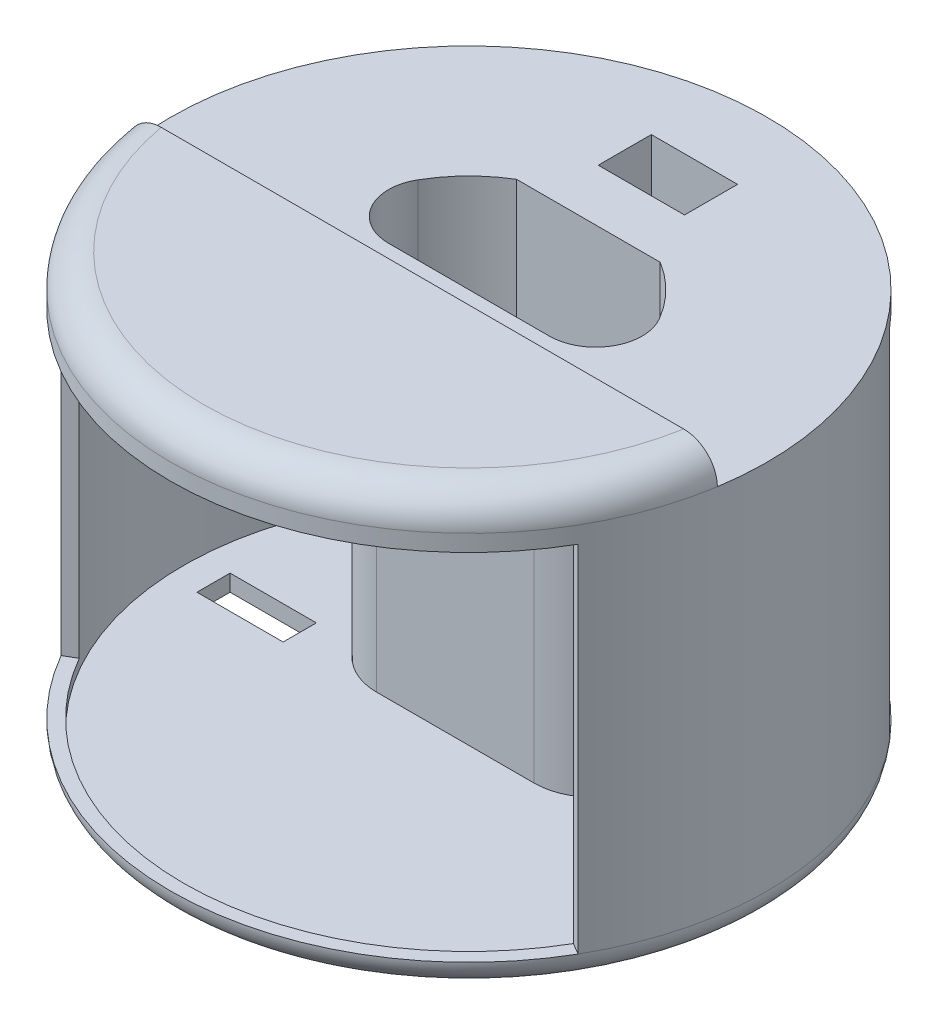
from build123d import *

# Parameters (mm, degrees)
CUT_EXTRUDE1_DEPTH           = 5
CUT_EXTRUDE3_DEPTH           = 60
SKETCH8_R                    = 43
CUT_EXTRUDE4_DEPTH           = 55
FILLET1_R                    = 7
SKETCH12_W                   = 6.5
SKETCH12_H                   = 53.5
CUT_REVOLVE1_ANGLE           = 60
CUT_REVOLVE1_OTHER_WAY_ANGLE = 60
SKETCH18_W                   = 13
SKETCH18_H                   = 8
CUT_EXTRUDE13_DEPTH          = 5
SKETCH20_W                   = 100
SKETCH20_H                   = 7
CUT_EXTRUDE15_DEPTH          = 5
SKETCH19_R                   = 1.5
CUT_EXTRUDE14_DEPTH          = 12
FILLET3_R                    = 4
SKETCH24_W                   = 2
SKETCH24_H                   = 3
BOSS_EXTRUDE3_DEPTH          = 2
CIRPATTERN2_COUNT            = 5
SKETCH26_W                   = 5
SKETCH26_H                   = 53.5
CUT_REVOLVE2_ANGLE           = 50
CUT_REVOLVE2_OTHER_WAY_ANGLE = 50
SKETCH29_W                   = 16.2
SKETCH29_H                   = 11.2
SKETCH29_W_2                 = 13
SKETCH29_H_2                 = 8
BOSS_EXTRUDE4_DEPTH          = 19
SKETCH36_W                   = 2
SKETCH36_H                   = 2
BOSS_EXTRUDE7_DEPTH          = 5
SKETCH37_W                   = 2
SKETCH37_H                   = 2
BOSS_EXTRUDE8_DEPTH          = 12.5
SKETCH40_W                   = 2
SKETCH40_H                   = 2
BOSS_EXTRUDE9_DEPTH          = 5
FILLET8_R                    = 9
SKETCH50_W                   = 13
SKETCH50_H                   = 5
CUT_EXTRUDE23_DEPTH          = 7


with BuildPart() as part:
    # Sketch1 → Revolve1 (revolve)
    with BuildSketch(Plane.XY, mode=Mode.PRIVATE) as revolve1_sk:
        with BuildLine():
            Line((0, 76.5), (0, 11.5))
            Line((0, 11.5), (22.5, 11.5))
            Line((22.5, 11.5), (22.5, 0))
            Line((22.5, 0), (25, 0))
            Line((25, 0), (25, 11.5))
            Line((25, 11.5), (45, 11.5))
            Line((45, 11.5), (45, 71.5))
            ThreePointArc((45, 71.5), (43.535533906, 75.035533906), (40, 76.5))
            Line((40, 76.5), (0, 76.5))
        make_face()
    revolve(revolve1_sk.sketch.rotate(Axis((0, 2, 0), (0, 1, 0)), 90), axis=Axis((0, 2, 0), (0, 1, 0)))

    # Sketch5 → Cut-Extrude1 (cut)
    with BuildSketch(Plane(origin=(0, 76.5, 0), x_dir=(1, 0, 0), z_dir=(0, 1, 0))):
        with BuildLine():
            Line((-45, 0), (45, 0))
            ThreePointArc((45, 0), (0, 45), (-45, 0))
        make_face()
    extrude(amount=-CUT_EXTRUDE1_DEPTH, mode=Mode.SUBTRACT)

    # Sketch7 → Cut-Extrude3 (cut)
    with BuildSketch(Plane.XZ.offset(-11.5)):
        with BuildLine():
            Line((21, 0), (-21, 0))
            ThreePointArc((-21, 0), (-18.277714988, -10.340461055), (-10.816653826, -18))
            Line((-10.816653826, -18), (10.816653826, -18))
            ThreePointArc((10.816653826, -18), (18.277714988, -10.340461055), (21, 0))
        make_face()
    extrude(amount=-CUT_EXTRUDE3_DEPTH, mode=Mode.SUBTRACT)

    # Sketch8 → Cut-Extrude4 (cut)
    with BuildSketch(Plane(origin=(0, 69, 0), x_dir=(1, 0, 0), z_dir=(0, 1, 0))):
        with Locations(Location((0, 0, 0), (0, 0, 270))):
            Circle(SKETCH8_R)
        with BuildLine():
            Line((22.912878475, -2), (-22.981606036, -2))
            ThreePointArc((-22.981606036, -2), (-20.067855169, 10.855581536), (-10.573881727, 20))
            Line((-10.573881727, 20), (10.505154166, 20))
            ThreePointArc((10.505154166, 20), (19.999127608, 10.855581536), (22.912878475, -2))
        make_face(mode=Mode.SUBTRACT)
    extrude(amount=-CUT_EXTRUDE4_DEPTH, mode=Mode.SUBTRACT)

    # Fillet1
    fillet1_edges = [part.edges().sort_by_distance(p)[0] for p in [
        (-21, 41.5, 0),
        (21, 41.5, 0),
    ]]
    fillet(fillet1_edges, radius=FILLET1_R)

    # Sketch12 → Cut-Revolve1 (revolve, cut)
    with BuildSketch(Plane(origin=(0, 0, 0), x_dir=(0, 0, -1), z_dir=(1, 0, 0))):
        with Locations((-44.75, 42.25)):
            Rectangle(SKETCH12_W, SKETCH12_H)
    revolve(axis=Axis((0, 71.5, 0), (0, -1, 0)), revolution_arc=CUT_REVOLVE1_ANGLE, mode=Mode.SUBTRACT)

    # Sketch12 → Cut-Revolve1 other way (revolve, cut)
    with BuildSketch(Plane(origin=(0, 0, 0), x_dir=(0, 0, -1), z_dir=(1, 0, 0))):
        with Locations((-44.75, 42.25)):
            Rectangle(SKETCH12_W, SKETCH12_H)
    revolve(axis=Axis((0, 71.5, 0), (0, 1, 0)), revolution_arc=CUT_REVOLVE1_OTHER_WAY_ANGLE, mode=Mode.SUBTRACT)

    # Sketch18 → Cut-Extrude13 (cut)
    with BuildSketch(Plane(origin=(0, 71.5, 0), x_dir=(1, 0, 0), z_dir=(0, 1, 0))):
        with Locations((0, 30)):
            Rectangle(SKETCH18_W, SKETCH18_H)
    extrude(amount=-CUT_EXTRUDE13_DEPTH, mode=Mode.SUBTRACT)

    # Sketch20 → Cut-Extrude15 (cut)
    with BuildSketch(Plane(origin=(0, 76.5, 0), x_dir=(1, 0, 0), z_dir=(0, 1, 0))):
        with Locations((0, -3.5)):
            Rectangle(SKETCH20_W, SKETCH20_H)
    extrude(amount=-CUT_EXTRUDE15_DEPTH, mode=Mode.SUBTRACT)

    # Sketch19 → Cut-Extrude14 (cut)
    with BuildSketch(Plane(origin=(0, 0, 7), x_dir=(-1, 0, 0), z_dir=(0, 0, -1))):
        with Locations((0, 74)):
            Circle(SKETCH19_R)
        with Locations((-30, 74)):
            Circle(SKETCH19_R)
        with Locations((29.452221542, 74)):
            Circle(SKETCH19_R)
    extrude(amount=-CUT_EXTRUDE14_DEPTH, mode=Mode.SUBTRACT)

    # Fillet3
    fillet3_edges = [part.edges().sort_by_distance(p)[0] for p in [
        (0, 11.5, 45),
    ]]
    fillet(fillet3_edges, radius=FILLET3_R - 0.0001)  # a hair under: the kernel refuses the full size

    # Sketch24 → Boss-Extrude3 (add)
    with BuildSketch(Plane.XZ):
        with Locations((0, -22.5)):
            Rectangle(SKETCH24_W, SKETCH24_H)
    boss_extrude3 = extrude(amount=-BOSS_EXTRUDE3_DEPTH)

    # CirPattern2: Boss-Extrude3 ×5 about axis
    cirpattern2_axis = Axis((0, 0, 0), (0, 1, 0))
    for i in range(1, CIRPATTERN2_COUNT):
        add(boss_extrude3.rotate(cirpattern2_axis, i * 360 / CIRPATTERN2_COUNT))

    # Sketch26 → Cut-Revolve2 (revolve, cut)
    with BuildSketch(Plane(origin=(0, 0, 0), x_dir=(0, 0, -1), z_dir=(1, 0, 0))):
        with Locations((45.056943441, 42.25)):
            Rectangle(SKETCH26_W, SKETCH26_H)
    revolve(axis=Axis((0, 2, 0), (0, -1, 0)), revolution_arc=CUT_REVOLVE2_ANGLE, mode=Mode.SUBTRACT)

    # Sketch26 → Cut-Revolve2 other way (revolve, cut)
    with BuildSketch(Plane(origin=(0, 0, 0), x_dir=(0, 0, -1), z_dir=(1, 0, 0))):
        with Locations((45.056943441, 42.25)):
            Rectangle(SKETCH26_W, SKETCH26_H)
    revolve(axis=Axis((0, 2, 0), (0, 1, 0)), revolution_arc=CUT_REVOLVE2_OTHER_WAY_ANGLE, mode=Mode.SUBTRACT)

    # Sketch29 → Boss-Extrude4 (add)
    with BuildSketch(Plane.XZ.offset(-69)):
        with Locations((0, -30)):
            Rectangle(SKETCH29_W, SKETCH29_H)
        with Locations((0, -30)):
            Rectangle(SKETCH29_W_2, SKETCH29_H_2, mode=Mode.SUBTRACT)
    extrude(amount=BOSS_EXTRUDE4_DEPTH)

    # Fillet8
    fillet8_edges = [part.edges().sort_by_distance(p)[0] for p in [
        (-22.981606036, 41.5, 2),
        (22.912878475, 41.5, 2),
    ]]
    fillet(fillet8_edges, radius=FILLET8_R)

    # Sketch50 → Cut-Extrude23 (cut)
    with BuildSketch(Plane(origin=(0, 14, 0), x_dir=(1, 0, 0), z_dir=(0, 1, 0))):
        with Locations((32, 0)):
            Rectangle(SKETCH50_W, SKETCH50_H)
        with Locations((-32, 0)):
            Rectangle(SKETCH50_W, SKETCH50_H)
    extrude(amount=-CUT_EXTRUDE23_DEPTH, mode=Mode.SUBTRACT)


with BuildPart() as body_2:
    # Sketch36 → Boss-Extrude7 (new body)
    with BuildSketch(Plane(origin=(0, 0, -35.6), x_dir=(-1, 0, 0), z_dir=(0, 0, -1))):
        with Locations((-6.159647943, 37.918102195)):
            Rectangle(SKETCH36_W, SKETCH36_H)
    extrude(amount=BOSS_EXTRUDE7_DEPTH)

    # Sketch37 → Boss-Extrude8 (add)
    with BuildSketch(Plane.ZY.offset(-5.159647943)):
        with Locations((-39.597351245, 37.918102195)):
            Rectangle(SKETCH37_W, SKETCH37_H)
    extrude(amount=BOSS_EXTRUDE8_DEPTH)

    # Sketch40 → Boss-Extrude9 (add)
    with BuildSketch(Plane(origin=(0, 0, -35.6), x_dir=(-1, 0, 0), z_dir=(0, 0, -1))):
        with Locations((6.340352057, 37.918102195)):
            Rectangle(SKETCH40_W, SKETCH40_H)
    extrude(amount=BOSS_EXTRUDE9_DEPTH)


solid = Compound([part.part, body_2.part])
